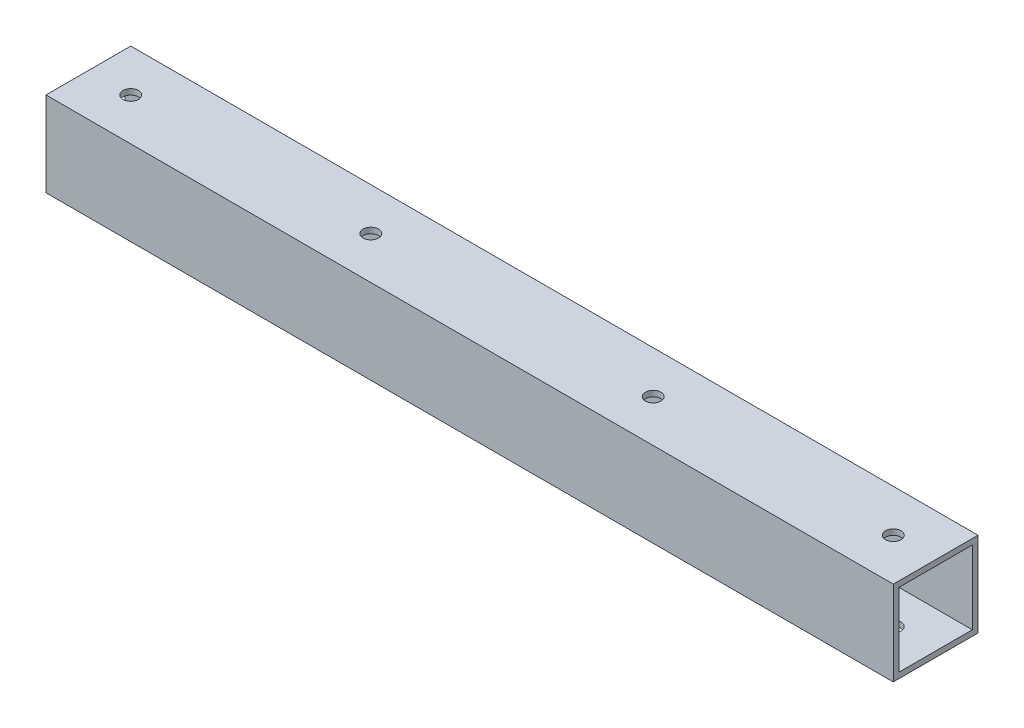
from build123d import *

# Parameters (mm, degrees)
SKETCH1_W               = 30
SKETCH1_H               = 30
SKETCH1_W_2             = 26
SKETCH1_H_2             = 26
BOSS_EXTRUDE1_DEPTH     = 150
SKETCH2_R               = 2.75
CUT_EXTRUDE1_DEPTH      = 152.492574075
CUT_EXTRUDE2_DEPTH      = 152.492574075
CUT_EXTRUDE2_DEPTH_BACK = 152.492574075
SKETCH3_R               = 2.75


with BuildPart() as part:
    # Sketch1 → Boss-Extrude1 (new, symmetric)
    with BuildSketch(Plane(origin=(0, 0, 0), x_dir=(0, 0, -1), z_dir=(1, 0, 0))):
        Rectangle(SKETCH1_W, SKETCH1_H)
        Rectangle(SKETCH1_W_2, SKETCH1_H_2, mode=Mode.SUBTRACT)
    extrude(amount=BOSS_EXTRUDE1_DEPTH, both=True)

    # Sketch2 → Cut-Extrude1 (cut, symmetric)
    with BuildSketch(Plane(origin=(0, 0, 0), x_dir=(1, 0, 0), z_dir=(0, 1, 0))):
        with Locations((135, 0)):
            Circle(SKETCH2_R)
    cut_extrude1 = extrude(amount=CUT_EXTRUDE1_DEPTH, both=True, mode=Mode.SUBTRACT)

    # Mirror1: Cut-Extrude1 across plane
    add(cut_extrude1.mirror(Plane(origin=(0, 0, 0), x_dir=(0, 0, 1), z_dir=(1, 0, 0))), mode=Mode.SUBTRACT)

    # Sketch3 → Cut-Extrude2 (cut, two sides: drawn at the far end of the back side and taken through both)
    with BuildSketch(Plane(origin=(0, 0, 0), x_dir=(1, 0, 0), z_dir=(0, 1, 0)).offset(-CUT_EXTRUDE2_DEPTH_BACK)):
        with Locations((50, 0)):
            Circle(SKETCH3_R)
        with Locations((-50, 0)):
            Circle(SKETCH3_R)
    extrude(amount=CUT_EXTRUDE2_DEPTH + CUT_EXTRUDE2_DEPTH_BACK, mode=Mode.SUBTRACT)


solid = part.part
